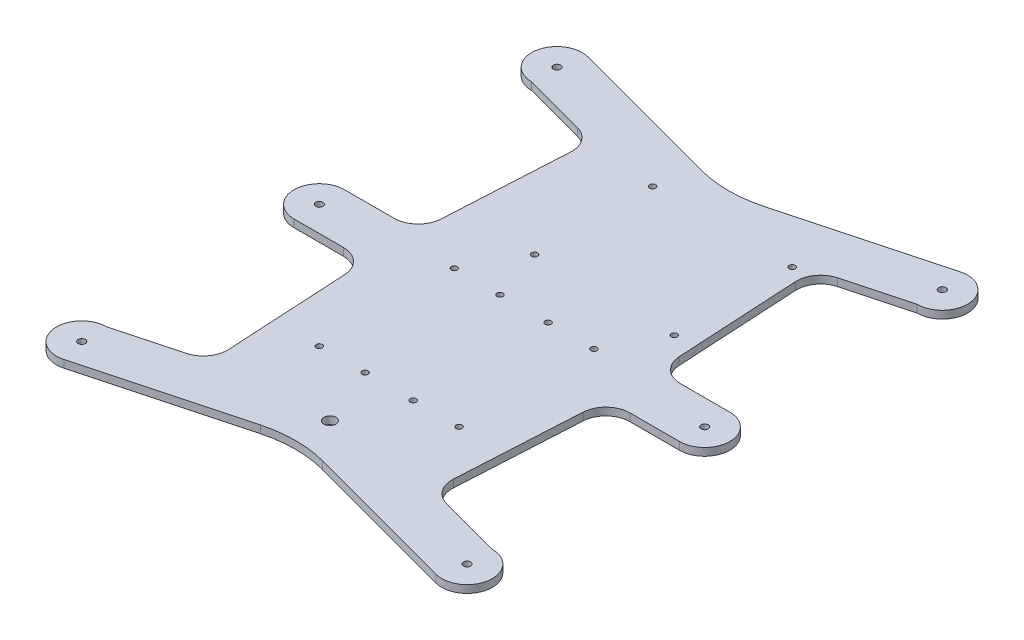
from build123d import *

# Parameters (mm, degrees)
SKETCH1_R               = 1.5
BOSS_EXTRUDE1_DEPTH     = 3.175
FILLET1_R               = 50
FILLET2_R               = 10
CUT_EXTRUDE1_DEPTH      = 142.82756039
CUT_EXTRUDE1_DEPTH_BACK = 142.82756039
SKETCH2_R               = 1.25
SKETCH2_R_2             = 2.5


with BuildPart() as part:
    # Sketch1 → Boss-Extrude1 (new body)
    with BuildSketch(Plane(origin=(0, 0, 0), x_dir=(1, 0, 0), z_dir=(0, 1, 0))):
        with BuildLine():
            Line((-80, 10.5), (-50, 10.5))
            Line((-50, 10.5), (-46.19259608, 79.095931406))
            Line((-46.19259608, 79.095931406), (-80, 88.154597985))
            ThreePointArc((-80, 88.154597985), (-90.410171044, 100.025123003), (-77.282400026, 108.796819161))
            Line((-77.282400026, 108.796819161), (0, 88.089062485))
            Line((0, 88.089062485), (77.282400026, 108.796819161))
            ThreePointArc((77.282400026, 108.796819161), (90.410171044, 100.025123003), (80, 88.154597985))
            Line((80, 88.154597985), (46.19259608, 79.095931406))
            Line((46.19259608, 79.095931406), (50, 10.5))
            Line((50, 10.5), (80, 10.5))
            ThreePointArc((80, 10.5), (90.5, 0), (80, -10.5))
            Line((80, -10.5), (50, -10.5))
            Line((50, -10.5), (46.19259608, -79.095931406))
            Line((46.19259608, -79.095931406), (80, -88.154597985))
            ThreePointArc((80, -88.154597985), (90.410171044, -100.025123003), (77.282400026, -108.796819161))
            Line((77.282400026, -108.796819161), (0, -88.089062485))
            Line((0, -88.089062485), (-77.282400026, -108.796819161))
            ThreePointArc((-77.282400026, -108.796819161), (-90.410171044, -100.025123003), (-80, -88.154597985))
            Line((-80, -88.154597985), (-46.19259608, -79.095931406))
            Line((-46.19259608, -79.095931406), (-50, -10.5))
            Line((-50, -10.5), (-80, -10.5))
            ThreePointArc((-80, -10.5), (-90.5, 0), (-80, 10.5))
        make_face()
        with Locations((-80, 98.654597985)):
            Circle(SKETCH1_R, mode=Mode.SUBTRACT)
        with Locations((-80, 0)):
            Circle(SKETCH1_R, mode=Mode.SUBTRACT)
        with Locations((80, 0)):
            Circle(SKETCH1_R, mode=Mode.SUBTRACT)
        with Locations((80, 98.654597985)):
            Circle(SKETCH1_R, mode=Mode.SUBTRACT)
        with Locations((80, -98.654597985)):
            Circle(SKETCH1_R, mode=Mode.SUBTRACT)
        with Locations((-80, -98.654597985)):
            Circle(SKETCH1_R, mode=Mode.SUBTRACT)
    extrude(amount=BOSS_EXTRUDE1_DEPTH)

    # Fillet1
    fillet1_edges = [part.edges().sort_by_distance(p)[0] for p in [
        (0, 1.5875, -88.089062485),
        (0, 1.5875, 88.089062485),
    ]]
    fillet(fillet1_edges, radius=FILLET1_R)

    # Fillet2
    fillet2_edges = [part.edges().sort_by_distance(p)[0] for p in [
        (46.19259608, 1.5875, 79.095931406),
        (50, 1.5875, 10.5),
        (50, 1.5875, -10.5),
        (46.19259608, 1.5875, -79.095931406),
        (-46.19259608, 1.5875, -79.095931406),
        (-50, 1.5875, -10.5),
        (-50, 1.5875, 10.5),
        (-46.19259608, 1.5875, 79.095931406),
    ]]
    fillet(fillet2_edges, radius=FILLET2_R)

    # Sketch2 → Cut-Extrude1 (cut, two sides: drawn at the far end of the back side and taken through both)
    with BuildSketch(Plane(origin=(0, 3.175, 0), x_dir=(1, 0, 0), z_dir=(0, 1, 0)).offset(-CUT_EXTRUDE1_DEPTH_BACK)):
        with Locations((-17.25, 75.618974869)):
            Circle(SKETCH2_R)
        with Locations((40.75, 75.618974869)):
            Circle(SKETCH2_R)
        with Locations((40.75, 26.618974869)):
            Circle(SKETCH2_R)
        with Locations((-17.25, 26.618974869)):
            Circle(SKETCH2_R)
        with Locations((0, -75.602871505)):
            Circle(SKETCH2_R_2)
        with Locations((-10, 5)):
            Circle(SKETCH2_R)
        with Locations((-10, -51)):
            Circle(SKETCH2_R)
        with Locations((-29, 5)):
            Circle(SKETCH2_R)
        with Locations((-29, -51)):
            Circle(SKETCH2_R)
        with Locations((29, -51)):
            Circle(SKETCH2_R)
        with Locations((29, 5)):
            Circle(SKETCH2_R)
        with Locations((10, -51)):
            Circle(SKETCH2_R)
        with Locations((10, 5)):
            Circle(SKETCH2_R)
    extrude(amount=CUT_EXTRUDE1_DEPTH + CUT_EXTRUDE1_DEPTH_BACK, mode=Mode.SUBTRACT)


solid = part.part
